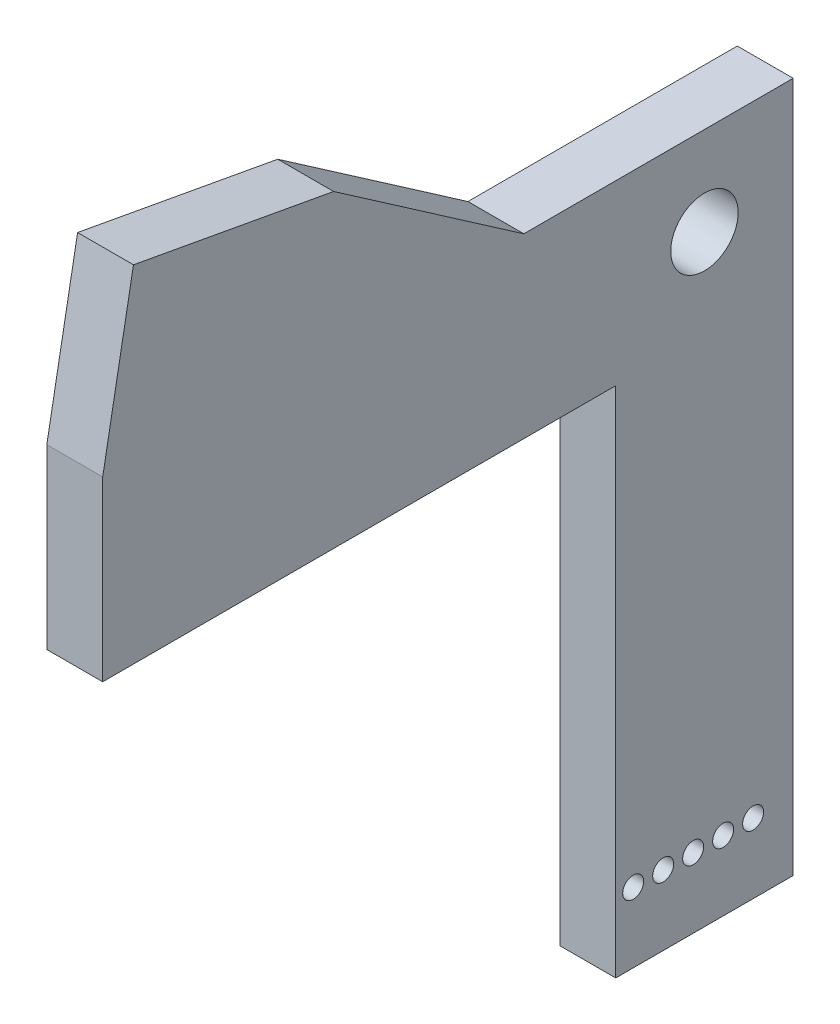
from build123d import *

# Parameters (mm, degrees)
SKETCH1_R           = 2.413
SKETCH1_R_2         = 0.75
BOSS_EXTRUDE1_DEPTH = 2


with BuildPart() as part:
    # Sketch1 → Boss-Extrude1 (new, symmetric)
    with BuildSketch(Plane(origin=(0, 0, 0), x_dir=(0, 0, -1), z_dir=(1, 0, 0))):
        Polygon((-40.864531886, 18.395870563), (-43.06614877, 6.35), (-43.06614877, -6.35), (-6.35, -6.35), (-6.35, -43.06614877), (6.35, -43.06614877), (6.35, 6.35), (-12.928006667, 6.35), (-26.539165493, 15.777631529), align=None)
        Circle(SKETCH1_R, mode=Mode.SUBTRACT)
        with Locations((1.336363636, -38.06614877)):
            Circle(SKETCH1_R_2, mode=Mode.SUBTRACT)
        with Locations((3.481818182, -38.06614877)):
            Circle(SKETCH1_R_2, mode=Mode.SUBTRACT)
        with Locations((-5.1, -38.06614877)):
            Circle(SKETCH1_R_2, mode=Mode.SUBTRACT)
        with Locations((-2.954545455, -38.06614877)):
            Circle(SKETCH1_R_2, mode=Mode.SUBTRACT)
        with Locations((-0.809090909, -38.06614877)):
            Circle(SKETCH1_R_2, mode=Mode.SUBTRACT)
    extrude(amount=BOSS_EXTRUDE1_DEPTH, both=True)


solid = part.part
